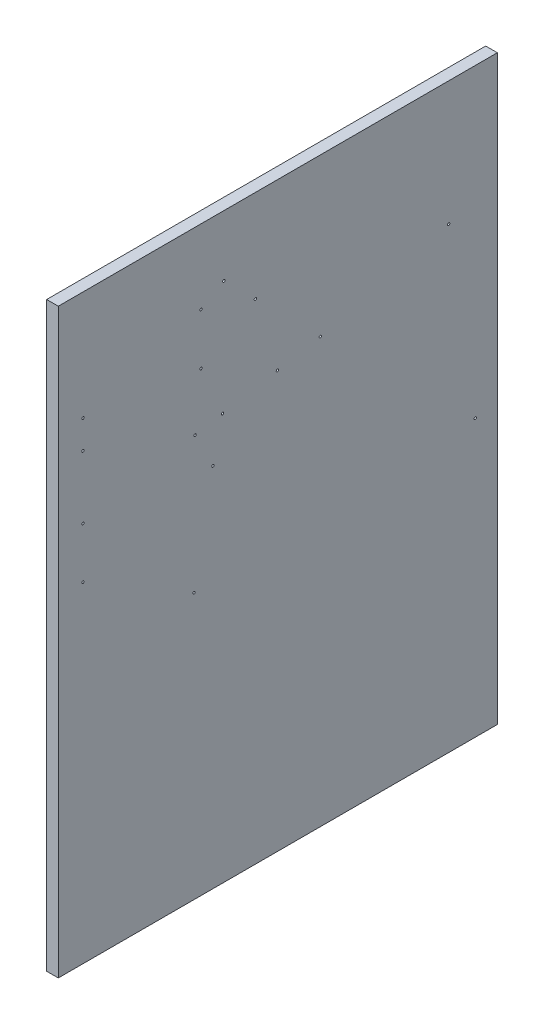
from build123d import *

# Parameters (mm, degrees)
SKETCH_1_W               = 566
SKETCH_1_H               = 750
EXTRUDE_1_DEPTH          = 15
SKETCH_3_R               = 4
CUT_EXTRUDE_1_DEPTH      = 10
CUT_EXTRUDE_2_DEPTH      = 650.08470809
CUT_EXTRUDE_2_DEPTH_BACK = 650.08470809
SKETCH_4_R               = 1.5


with BuildPart() as part:
    # Эскиз1 → Бобышка-Вытянуть1 (new body)
    with BuildSketch(Plane(origin=(0, 0, 0), x_dir=(0, 0, -1), z_dir=(1, 0, 0))):
        with Locations((208.477929059, 48.716182749)):
            Rectangle(SKETCH_1_W, SKETCH_1_H)
    extrude(amount=EXTRUDE_1_DEPTH)

    # Эскиз3 → Вырез-Вытянуть1 (cut)
    with BuildSketch(Plane.ZY):
        with Locations((-459.121136887, 408.987044781)):
            Circle(SKETCH_3_R)
    extrude(amount=-CUT_EXTRUDE_1_DEPTH, mode=Mode.SUBTRACT)

    # Эскиз4 → Вырез-Вытянуть2 (cut, two sides: drawn at the far end of the back side and taken through both)
    with BuildSketch(Plane.ZY.offset(-CUT_EXTRUDE_2_DEPTH_BACK)):
        with Locations((-138.909883055, 345.235633328)):
            Circle(SKETCH_4_R)
        with Locations((-179.495629652, 304.64988673)):
            Circle(SKETCH_4_R)
        with Locations((-263.2761242, 220.869392183)):
            Circle(SKETCH_4_R)
        with Locations((-207.931126478, 210.859443585)):
            Circle(SKETCH_4_R)
        with Locations((-137.119879485, 197.982216734)):
            Circle(SKETCH_4_R)
        with Locations((42.714652053, 165.278795224)):
            Circle(SKETCH_4_R)
        with Locations((-124.831154964, 145.715565594)):
            Circle(SKETCH_4_R)
        with Locations((42.714652053, 99.692621204)):
            Circle(SKETCH_4_R)
        with Locations((-100.410954005, 16.360792756)):
            Circle(SKETCH_4_R)
        with Locations((-101.789718427, 191.557326369)):
            Circle(SKETCH_4_R)
        with Locations((42.714652053, 246.301380308)):
            Circle(SKETCH_4_R)
        with Locations((-428.821301923, 263.704028896)):
            Circle(SKETCH_4_R)
        with Locations((42.714652053, 282.872517245)):
            Circle(SKETCH_4_R)
        with Locations((-109.444727657, 262.061630053)):
            Circle(SKETCH_4_R)
        with Locations((-109.444727657, 327.974766948)):
            Circle(SKETCH_4_R)
        with Locations((-463.012887704, 29.966051081)):
            Circle(SKETCH_4_R)
    extrude(amount=CUT_EXTRUDE_2_DEPTH + CUT_EXTRUDE_2_DEPTH_BACK, mode=Mode.SUBTRACT)


solid = part.part
